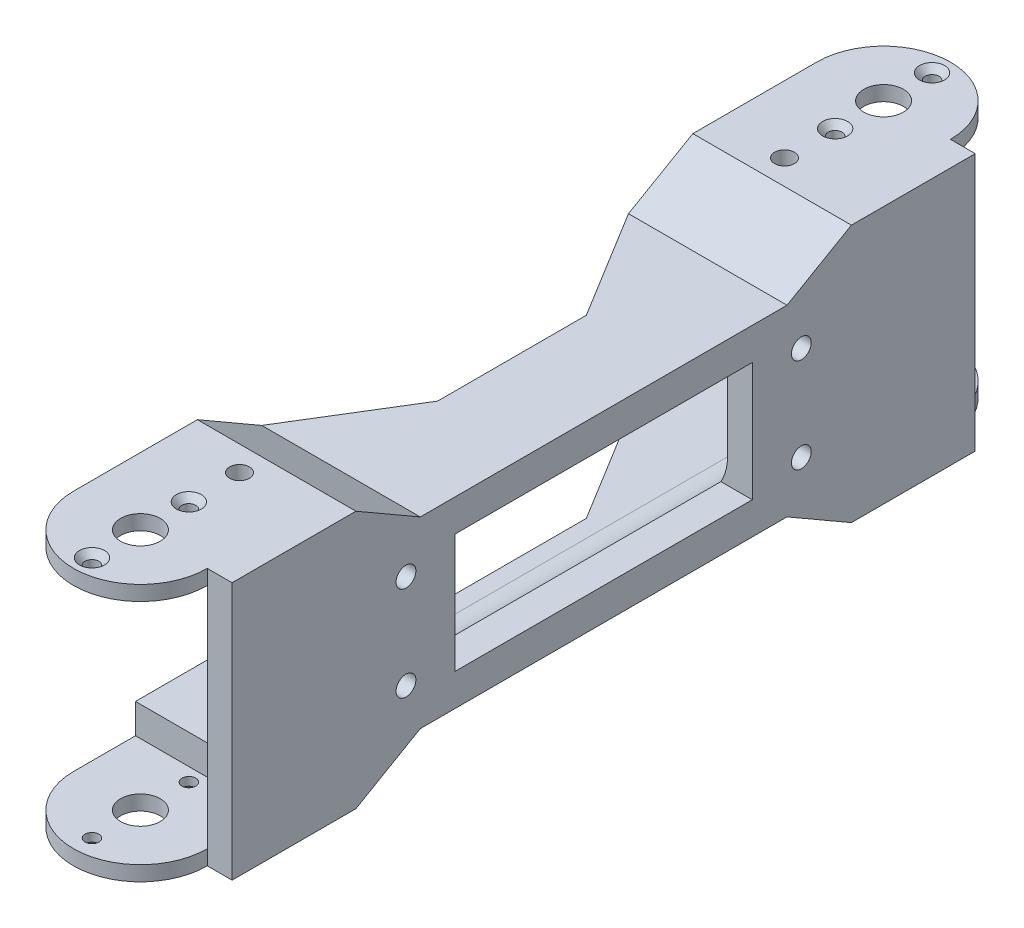
from build123d import *

# Parameters (mm, degrees)
SKETCH1_R                                     = 2
BOSS_EXTRUDE1_DEPTH                           = 26
CUT_EXTRUDE1_DEPTH                            = 97.110613358
CUT_EXTRUDE2_DEPTH                            = 97.110613358
CUT_EXTRUDE2_DEPTH_BACK                       = 97.110613358
SKETCH4_W                                     = 26
SKETCH4_H                                     = 6
SKETCH5_W                                     = 177
SKETCH5_H                                     = 34
CUT_EXTRUDE3_DEPTH                            = 22
SKETCH6_W                                     = 22.988088482
SKETCH6_H                                     = 34
CUT_EXTRUDE4_DEPTH                            = 95.827474922
SKETCH7_W                                     = 22.988088482
SKETCH7_H                                     = 34
CUT_EXTRUDE5_DEPTH                            = 95.827474922
CSK_FOR_3_FLAT_HEAD_MACHINE_SCREW1_AT_2_COUNT = 2
CSK_FOR_3_FLAT_HEAD_MACHINE_SCREW1_AT_2_PITCH = 19.558
SKETCH13_R                                    = 4
CUT_EXTRUDE6_DEPTH                            = 104.530188834
BOSS_EXTRUDE2_DEPTH                           = 5
SKETCH15_W                                    = 125
SKETCH15_H                                    = 34
CUT_EXTRUDE7_DEPTH                            = 5
SKETCH17_W                                    = 5
SKETCH17_H                                    = 52
BOSS_EXTRUDE4_DEPTH                           = 12.5
SKETCH19_R                                    = 2
CUT_EXTRUDE11_DEPTH                           = 10
CUT_EXTRUDE8_REACH                            = 106.3
SKETCH18_R                                    = 2
SKETCH20_W                                    = 60
SKETCH20_H                                    = 24
CUT_EXTRUDE10_DEPTH                           = 10
CUT_EXTRUDE12_REACH                           = 102.771
SKETCH22_W                                    = 5
SKETCH22_H                                    = 46
BOSS_EXTRUDE5_DEPTH                           = 12.5
FILLET1_R                                     = 10


with BuildPart() as part:
    # Sketch1 → Boss-Extrude1 (new, symmetric)
    with BuildSketch(Plane(origin=(0, 0, 0), x_dir=(1, 0, 0), z_dir=(0, 1, 0))):
        with BuildLine():
            Line((-13.5, 75), (-13.5, -75))
            ThreePointArc((-13.5, -75), (0, -88.5), (13.5, -75))
            Line((13.5, -75), (13.5, 75))
            ThreePointArc((13.5, 75), (0, 88.5), (-13.5, 75))
        make_face()
        with Locations(Location((0, -55, 0), (0, 0, 90))):
            Circle(SKETCH1_R, mode=Mode.SUBTRACT)
    extrude(amount=BOSS_EXTRUDE1_DEPTH, both=True)

    # Sketch3 → Cut-Extrude1 (cut, symmetric)
    with BuildSketch(Plane.ZY.offset(13.5)):
        Polygon((-50, 26), (-37.009618943, 18.5), (37.009618943, 18.5), (50, 26), align=None)
    cut_extrude1 = extrude(amount=CUT_EXTRUDE1_DEPTH, both=True, mode=Mode.SUBTRACT)

    # Mirror1: Cut-Extrude1 across plane
    add(cut_extrude1.mirror(Plane.ZX), mode=Mode.SUBTRACT)

    # Sketch4 → Cut-Extrude2 (cut, two sides: drawn at the far end of the back side and taken through both)
    with BuildSketch(Plane.ZY.offset(13.5).offset(-CUT_EXTRUDE2_DEPTH_BACK)):
        with Locations((75.5, 20)):
            Rectangle(SKETCH4_W, SKETCH4_H)
        with Locations((-75.5, 20)):
            Rectangle(SKETCH4_W, SKETCH4_H)
        with Locations((-75.5, -20)):
            Rectangle(SKETCH4_W, SKETCH4_H)
        with Locations((75.5, -20)):
            Rectangle(SKETCH4_W, SKETCH4_H)
    extrude(amount=CUT_EXTRUDE2_DEPTH + CUT_EXTRUDE2_DEPTH_BACK, mode=Mode.SUBTRACT)

    # Sketch5 → Cut-Extrude3 (cut)
    with BuildSketch(Plane.ZY.offset(13.5)):
        Rectangle(SKETCH5_W, SKETCH5_H)
    extrude(amount=-CUT_EXTRUDE3_DEPTH, mode=Mode.SUBTRACT)

    # Sketch6 → Cut-Extrude4 (cut, through all)
    with BuildSketch(Plane.ZY.offset(-8.5)):
        with Locations((73.994044241, 0)):
            Rectangle(SKETCH6_W, SKETCH6_H)
    extrude(amount=-CUT_EXTRUDE4_DEPTH, mode=Mode.SUBTRACT)

    # Sketch7 → Cut-Extrude5 (cut, through all)
    with BuildSketch(Plane.ZY.offset(-8.5)):
        with Locations((-73.994044241, 0)):
            Rectangle(SKETCH7_W, SKETCH7_H)
    extrude(amount=-CUT_EXTRUDE5_DEPTH, mode=Mode.SUBTRACT)

    # Sketch12 → CSK for #3 Flat Head Machine Screw1 (revolve, cut)
    with BuildSketch(Plane(origin=(0, 26, 65.221), x_dir=(0, 0, 1), z_dir=(1, 0, 0))):
        Polygon((0, 0), (0, 3.839402285), (1.397, 3), (1.397, 1.300261411), (2.5273, 0), align=None)
    csk_for_3_flat_head_machine_screw1 = revolve(axis=Axis((0, 32.35, 65.221), (0, -1, 0)), mode=Mode.SUBTRACT)

    # CSK for #3 Flat Head Machine Screw1 at 2: CSK for #3 Flat Head Machine Screw1 ×2
    with Locations(*[(0, 0, i * CSK_FOR_3_FLAT_HEAD_MACHINE_SCREW1_AT_2_PITCH) for i in range(1, CSK_FOR_3_FLAT_HEAD_MACHINE_SCREW1_AT_2_COUNT)]):
        add(csk_for_3_flat_head_machine_screw1, mode=Mode.SUBTRACT)

    # Mirror5: CSK for #3 Flat Head Machine Screw1 across plane
    add(csk_for_3_flat_head_machine_screw1.mirror(Plane.ZX), mode=Mode.SUBTRACT)

    # Mirror5 copy 1 sketch → Mirror5 copy 1 (revolve, cut)
    with BuildSketch(Plane(origin=(0, -26, 84.779), x_dir=(0, 0, 1), z_dir=(1, 0, 0))):
        Polygon((0, 0), (0, -3.839402285), (1.397, -3), (1.397, -1.300261411), (2.5273, 0), align=None)
    revolve(axis=Axis((0, -32.35, 84.779), (0, -1, 0)), mode=Mode.SUBTRACT)

    # Mirror3: CSK for #3 Flat Head Machine Screw1 across plane
    add(csk_for_3_flat_head_machine_screw1.mirror(Plane.XY), mode=Mode.SUBTRACT)

    # Mirror3 copy 1 sketch → Mirror3 copy 1 (revolve, cut)
    with BuildSketch(Plane(origin=(0, 26, -84.779), x_dir=(0, 0, -1), z_dir=(1, 0, 0))):
        Polygon((0, 0), (0, -3.839402285), (1.397, -3), (1.397, -1.300261411), (2.5273, 0), align=None)
    revolve(axis=Axis((0, 32.35, -84.779), (0, 1, 0)), mode=Mode.SUBTRACT)

    # Sketch13 → Cut-Extrude6 (cut, symmetric)
    with BuildSketch(Plane.XZ.offset(26)):
        with Locations(Location((0, -75, 0), (0, 0, 270))):
            Circle(SKETCH13_R)
    cut_extrude6 = extrude(amount=CUT_EXTRUDE6_DEPTH, both=True, mode=Mode.SUBTRACT)

    # Mirror4: Cut-Extrude6 across plane
    add(cut_extrude6.mirror(Plane.XY), mode=Mode.SUBTRACT)

    # Sketch14 → Boss-Extrude2 (add)
    with BuildSketch(Plane(origin=(13.5, 0, 0), x_dir=(0, 0, -1), z_dir=(1, 0, 0))):
        Polygon((-75, 26), (-75, 23), (-62.5, 23), (-62.5, -23), (-75, -23), (-75, -26), (-50, -26), (-37.009618943, -18.5), (37.009618943, -18.5), (50, -26), (75, -26), (75, -23), (62.5, -23), (62.5, 23), (75, 23), (75, 26), (50, 26), (37.009618943, 18.5), (-37.009618943, 18.5), (-50, 26), align=None)
    extrude(amount=BOSS_EXTRUDE2_DEPTH)

    # Sketch15 → Cut-Extrude7 (cut)
    with BuildSketch(Plane.ZY.offset(-8.5)):
        Rectangle(SKETCH15_W, SKETCH15_H)
    extrude(amount=-CUT_EXTRUDE7_DEPTH, mode=Mode.SUBTRACT)

    # Sketch17 → Boss-Extrude4 (add)
    with BuildSketch(Plane.XY.offset(62.5)):
        with Locations((16, 0)):
            Rectangle(SKETCH17_W, SKETCH17_H)
    extrude(amount=BOSS_EXTRUDE4_DEPTH)

    # Mirror6 copy 1 sketch → Mirror6 copy 1 (revolve, cut)
    with BuildSketch(Plane(origin=(0, -26, -65.221), x_dir=(0, 0, -1), z_dir=(1, 0, 0))):
        Polygon((0, 0), (0, 3.839402285), (1.397, 3), (1.397, 1.300261411), (2.5273, 0), align=None)
    revolve(axis=Axis((0, -32.35, -65.221), (0, 1, 0)), mode=Mode.SUBTRACT)

    # Mirror6 copy 2 sketch → Mirror6 copy 2 (revolve, cut)
    with BuildSketch(Plane(origin=(0, -26, -84.779), x_dir=(0, 0, -1), z_dir=(1, 0, 0))):
        Polygon((0, 0), (0, 3.839402285), (1.397, 3), (1.397, 1.300261411), (2.5273, 0), align=None)
    revolve(axis=Axis((0, -32.35, -84.779), (0, 1, 0)), mode=Mode.SUBTRACT)

    # Mirror6 copy 3 sketch → Mirror6 copy 3 (revolve, cut)
    with BuildSketch(Plane(origin=(0, -26, 65.221), x_dir=(0, 0, 1), z_dir=(1, 0, 0))):
        Polygon((0, 0), (0, -3.839402285), (1.397, -3), (1.397, -1.300261411), (2.5273, 0), align=None)
    revolve(axis=Axis((0, -32.35, 65.221), (0, -1, 0)), mode=Mode.SUBTRACT)

    # Mirror6 copy 4 sketch → Mirror6 copy 4 (revolve, cut)
    with BuildSketch(Plane(origin=(0, -26, 84.779), x_dir=(0, 0, 1), z_dir=(1, 0, 0))):
        Polygon((0, 0), (0, -3.839402285), (1.397, -3), (1.397, -1.300261411), (2.5273, 0), align=None)
    revolve(axis=Axis((0, -32.35, 84.779), (0, -1, 0)), mode=Mode.SUBTRACT)

    # Sketch19 → Cut-Extrude11 (cut)
    with BuildSketch(Plane(origin=(18.5, 0, 0), x_dir=(0, 0, -1), z_dir=(1, 0, 0))):
        with Locations((-39.898979486, 9.525)):
            Circle(SKETCH19_R)
        with Locations((-39.898979486, -9.525)):
            Circle(SKETCH19_R)
    cut_extrude11 = extrude(amount=-CUT_EXTRUDE11_DEPTH, mode=Mode.SUBTRACT)

    # Cut-Extrude8: up to this face of the body (flat: up to its plane)
    cut_extrude8_end = Plane(part.part.faces().sort_by_distance((0, -26, -87.99937539))[0])
    # Sketch18 → Cut-Extrude8 (cut, up to the picked face)
    with BuildSketch(Plane(origin=(0, 26, 0), x_dir=(1, 0, 0), z_dir=(0, 1, 0)), mode=Mode.PRIVATE) as cut_extrude8_sk1:
        with Locations(Location((0, 55, 0), (0, 0, 270))):
            Circle(SKETCH18_R)
    cut_extrude8_tool1 = split(extrude(cut_extrude8_sk1.sketch, amount=-CUT_EXTRUDE8_REACH, mode=Mode.PRIVATE), bisect_by=cut_extrude8_end, keep=Keep.BOTH, mode=Mode.PRIVATE)
    add(cut_extrude8_tool1.solids().sort_by(Axis((0, 26, -55), (0, -1, 0)))[0], mode=Mode.SUBTRACT)

    # Sketch20 → Cut-Extrude10 (cut)
    with BuildSketch(Plane.ZY.offset(-13.5)):
        Rectangle(SKETCH20_W, SKETCH20_H)
    extrude(amount=-CUT_EXTRUDE10_DEPTH, mode=Mode.SUBTRACT)

    # Mirror7: Cut-Extrude11 across plane
    add(cut_extrude11.mirror(Plane.XY), mode=Mode.SUBTRACT)

    # Cut-Extrude12: up to this face of the body (flat: up to its plane)
    cut_extrude12_end = Plane(part.part.faces().sort_by_distance((2.5, -18.5, 0))[0])
    # Sketch21 → Cut-Extrude12 (cut, up to the picked face)
    with BuildSketch(Plane(origin=(0, 18.5, 0), x_dir=(1, 0, 0), z_dir=(0, 1, 0)), mode=Mode.PRIVATE) as cut_extrude12_sk1:
        Polygon((-13.5, 37.009618943), (0, 15), (0, -15), (-13.5, -37.009618943), align=None)
    cut_extrude12_tool1 = split(extrude(cut_extrude12_sk1.sketch, amount=-CUT_EXTRUDE12_REACH, mode=Mode.PRIVATE), bisect_by=cut_extrude12_end, keep=Keep.BOTH, mode=Mode.PRIVATE)
    add(cut_extrude12_tool1.solids().sort_by(Axis((-7.702163, 18.5, 0), (0, -1, 0)))[0], mode=Mode.SUBTRACT)

    # Sketch22 → Boss-Extrude5 (add)
    with BuildSketch(Plane(origin=(0, 0, -62.5), x_dir=(-1, 0, 0), z_dir=(0, 0, -1))):
        with Locations((-16, 0)):
            Rectangle(SKETCH22_W, SKETCH22_H)
    extrude(amount=BOSS_EXTRUDE5_DEPTH)

    # Fillet1
    # the kernel refuses this fillet: 10 mm, written as the material it adds along each edge
    with BuildSketch(Plane(origin=(13.5, 17, -62.5), x_dir=(0, -1, 0), z_dir=(0, 0, 1))) as fillet1_piece_1_section:
        with BuildLine():
            CenterArc((FILLET1_R, -FILLET1_R), FILLET1_R, 90, 90)
            Line((0, -FILLET1_R), (0, 0))
            Line((0, 0), (FILLET1_R, 0))
        make_face()
    fillet1_piece_1 = extrude(amount=150, mode=Mode.PRIVATE)
    fillet1_piece_1 = fillet1_piece_1 - Plane(origin=(13.095089825, 9.525, -39.898979486), x_dir=(0, 0, 1), z_dir=(1, 0, 0)) * Cylinder(2, 341, mode=Mode.PRIVATE)
    fillet1_piece_1 = split(fillet1_piece_1, bisect_by=Plane(origin=(13.095089825, 10.807057583, -30), z_dir=(0, 0, -1)), keep=Keep.TOP, mode=Mode.PRIVATE)
    add(fillet1_piece_1)
    with BuildSketch(Plane(origin=(13.5, 17, -62.5), x_dir=(0, -1, 0), z_dir=(0, 0, 1))) as fillet1_piece_2_section:
        with BuildLine():
            CenterArc((FILLET1_R, -FILLET1_R), FILLET1_R, 90, 90)
            Line((0, -FILLET1_R), (0, 0))
            Line((0, 0), (FILLET1_R, 0))
        make_face()
    fillet1_piece_2 = extrude(amount=125, mode=Mode.PRIVATE)
    fillet1_piece_2 = split(fillet1_piece_2, bisect_by=Plane(origin=(11.059751506, 12, 0), z_dir=(0, 1, 0)), keep=Keep.TOP, mode=Mode.PRIVATE)
    add(fillet1_piece_2)
    with BuildSketch(Plane(origin=(13.5, 17, -87.5), x_dir=(0, -1, 0), z_dir=(0, 0, 1))) as fillet1_piece_3_section:
        with BuildLine():
            CenterArc((FILLET1_R, -FILLET1_R), FILLET1_R, 90, 90)
            Line((0, -FILLET1_R), (0, 0))
            Line((0, 0), (FILLET1_R, 0))
        make_face()
    fillet1_piece_3 = extrude(amount=150, mode=Mode.PRIVATE)
    fillet1_piece_3 = fillet1_piece_3 - Plane(origin=(13.095089825, 9.525, 39.898979486), x_dir=(0, 0, -1), z_dir=(1, 0, 0)) * Cylinder(2, 341, mode=Mode.PRIVATE)
    fillet1_piece_3 = split(fillet1_piece_3, bisect_by=Plane(origin=(13.095089825, 10.807057583, 30), z_dir=(0, 0, 1)), keep=Keep.TOP, mode=Mode.PRIVATE)
    add(fillet1_piece_3)
    with BuildSketch(Plane(origin=(13.5, -17, 62.5), x_dir=(-1, 0, 0), z_dir=(0, 0, -1))) as fillet1_piece_4_section:
        with BuildLine():
            CenterArc((FILLET1_R, FILLET1_R), FILLET1_R, 180, 90)
            Line((0, FILLET1_R), (0, 0))
            Line((0, 0), (FILLET1_R, 0))
        make_face()
    fillet1_piece_4 = extrude(amount=125, mode=Mode.PRIVATE)
    fillet1_piece_4 = split(fillet1_piece_4, bisect_by=Plane(origin=(11.059751506, -12, 46.25), z_dir=(0, -1, 0)), keep=Keep.TOP, mode=Mode.PRIVATE)
    add(fillet1_piece_4)
    with BuildSketch(Plane(origin=(13.5, -17, 62.5), x_dir=(-1, 0, 0), z_dir=(0, 0, -1))) as fillet1_piece_5_section:
        with BuildLine():
            CenterArc((FILLET1_R, FILLET1_R), FILLET1_R, 180, 90)
            Line((0, FILLET1_R), (0, 0))
            Line((0, 0), (FILLET1_R, 0))
        make_face()
    fillet1_piece_5 = extrude(amount=150, mode=Mode.PRIVATE)
    fillet1_piece_5 = split(fillet1_piece_5, bisect_by=Plane(origin=(13.095085978, -10.807036513, 30), z_dir=(0, 0, 1)), keep=Keep.TOP, mode=Mode.PRIVATE)
    fillet1_piece_5 = fillet1_piece_5 - Plane(origin=(13.095085978, -9.525, 39.898979486), x_dir=(0, 0, -1), z_dir=(1, 0, 0)) * Cylinder(2, 341, mode=Mode.PRIVATE)
    add(fillet1_piece_5)
    with BuildSketch(Plane(origin=(13.5, -17, 87.5), x_dir=(-1, 0, 0), z_dir=(0, 0, -1))) as fillet1_piece_6_section:
        with BuildLine():
            CenterArc((FILLET1_R, FILLET1_R), FILLET1_R, 180, 90)
            Line((0, FILLET1_R), (0, 0))
            Line((0, 0), (FILLET1_R, 0))
        make_face()
    fillet1_piece_6 = extrude(amount=150, mode=Mode.PRIVATE)
    fillet1_piece_6 = split(fillet1_piece_6, bisect_by=Plane(origin=(13.095085978, -10.807036513, -30), z_dir=(0, 0, -1)), keep=Keep.TOP, mode=Mode.PRIVATE)
    fillet1_piece_6 = fillet1_piece_6 - Plane(origin=(13.095085978, -9.525, -39.898979486), x_dir=(0, 0, 1), z_dir=(1, 0, 0)) * Cylinder(2, 341, mode=Mode.PRIVATE)
    add(fillet1_piece_6)


solid = part.part
